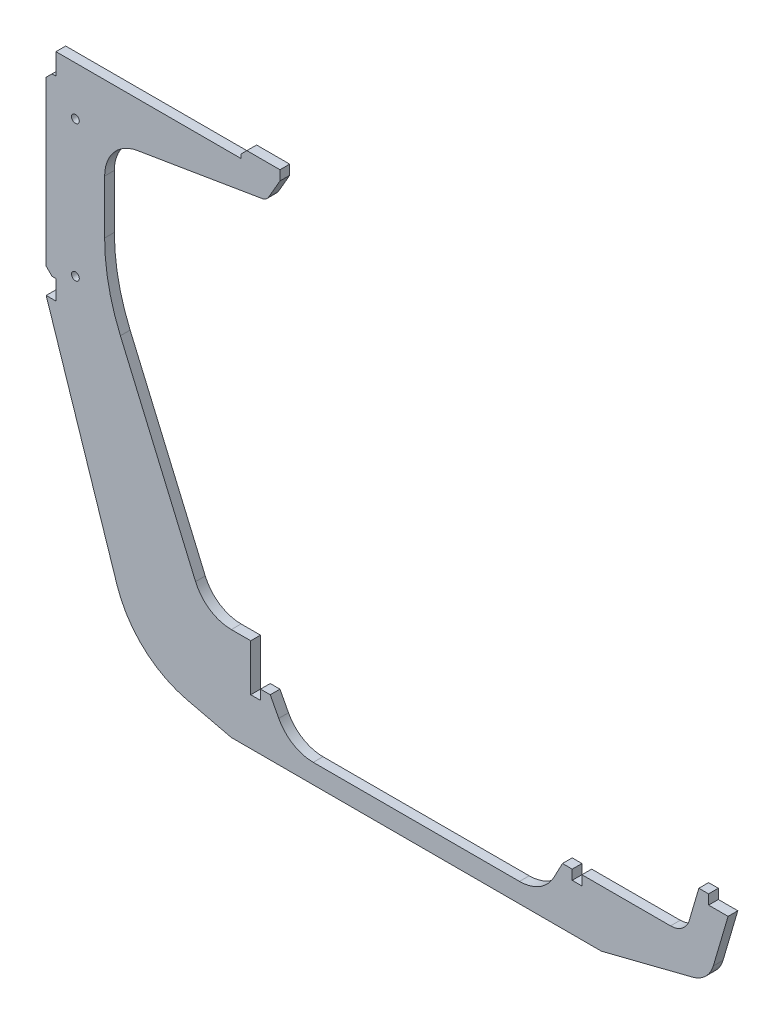
from build123d import *

# Parameters (mm, degrees)
SZKIC1_R                    = 2
DODANIE_WYCI_GNI_CIE1_DEPTH = 5


with BuildPart() as part:
    # Szkic1 → Dodanie-wyciągnięcie1 (new body)
    with BuildSketch(Plane.XY):
        with BuildLine():
            Line((-65.202627062, -126.434402055), (124.797372938, -126.434402055))
            Line((124.797372938, -126.434402055), (171.499327319, -114.603240278))
            ThreePointArc((171.499327319, -114.603240278), (178.222064331, -110.865700346), (182.208416061, -104.287448484))
            Line((182.208416061, -104.287448484), (189.797372938, -78.434402055))
            Line((189.797372938, -78.434402055), (179.797372938, -78.434402055))
            Line((179.797372938, -78.434402055), (179.797372938, -73.434402055))
            Line((179.797372938, -73.434402055), (174.797372938, -73.434402055))
            Line((174.797372938, -73.434402055), (169.860999207, -90.250981899))
            ThreePointArc((169.860999207, -90.250981899), (166.258938288, -95.439581579), (160.265850538, -97.434402055))
            Line((160.265850538, -97.434402055), (114.797372938, -97.434402055))
            Line((114.797372938, -97.434402055), (114.797372938, -102.434402055))
            Line((114.797372938, -102.434402055), (109.797372938, -102.434402055))
            Line((109.797372938, -102.434402055), (109.797372938, -97.434402055))
            Line((109.797372938, -97.434402055), (104.797372938, -97.434402055))
            Line((104.797372938, -97.434402055), (100.421094698, -105.749330711))
            ThreePointArc((100.421094698, -105.749330711), (93.059592126, -113.556004975), (82.72273025, -116.434402055))
            Line((82.72273025, -116.434402055), (-23.127984374, -116.434402055))
            ThreePointArc((-23.127984374, -116.434402055), (-33.464846249, -113.556004975), (-40.826348821, -105.749330711))
            Line((-40.826348821, -105.749330711), (-45.202627062, -97.434402055))
            Line((-45.202627062, -97.434402055), (-50.202627062, -97.434402055))
            Line((-50.202627062, -97.434402055), (-50.202627062, -102.434402055))
            Line((-50.202627062, -102.434402055), (-55.202627062, -102.434402055))
            Line((-55.202627062, -102.434402055), (-55.202627062, -78.434402055))
            Line((-55.202627062, -78.434402055), (-65.157561045, -78.434402055))
            ThreePointArc((-65.157561045, -78.434402055), (-76.16738122, -75.131223899), (-83.540461645, -66.312788026))
            Line((-83.540461645, -66.312788026), (-122.117130064, 23.699438283))
            ThreePointArc((-122.117130064, 23.699438283), (-128.160399342, 42.984780914), (-130.202627062, 63.091368141))
            Line((-130.202627062, 63.091368141), (-130.202627062, 90.623056178))
            ThreePointArc((-130.202627062, 90.623056178), (-125.463026711, 103.5505541), (-113.490606808, 110.350934654))
            Line((-113.490606808, 110.350934654), (-49.477900362, 121.019719062))
            ThreePointArc((-49.477900362, 121.019719062), (-47.45126243, 121.842517137), (-45.96976828, 123.451688681))
            Line((-45.96976828, 123.451688681), (-40.202627062, 133.440670285))
            Line((-40.202627062, 133.440670285), (-40.202627062, 138.440670285))
            Line((-40.202627062, 138.440670285), (-57.202627062, 138.440670285))
            Line((-57.202627062, 138.440670285), (-60.202627062, 135.440670285))
            Line((-60.202627062, 135.440670285), (-60.202627062, 133.440670285))
            Line((-60.202627062, 133.440670285), (-155.202627062, 133.440670285))
            Line((-155.202627062, 133.440670285), (-155.202627062, 122.565597945))
            Line((-155.202627062, 122.565597945), (-157.202627062, 122.565597945))
            Line((-157.202627062, 122.565597945), (-160.202627062, 119.565597945))
            Line((-160.202627062, 119.565597945), (-160.202627062, 35.565597945))
            Line((-160.202627062, 35.565597945), (-157.202627062, 32.565597945))
            Line((-157.202627062, 32.565597945), (-155.202627062, 32.565597945))
            Line((-155.202627062, 32.565597945), (-155.202627062, 22.565597945))
            Line((-155.202627062, 22.565597945), (-160.202627062, 22.565597945))
            Line((-160.202627062, 22.565597945), (-123.814002373, -88.030510267))
            ThreePointArc((-123.814002373, -88.030510267), (-110.145816986, -109.223759508), (-87.872395851, -121.050331967))
            Line((-87.872395851, -121.050331967), (-65.202627062, -126.434402055))
        make_face()
        with Locations((-145.202627062, 38.565597945)):
            Circle(SZKIC1_R, mode=Mode.SUBTRACT)
        with Locations((-145.202627062, 108.565597945)):
            Circle(SZKIC1_R, mode=Mode.SUBTRACT)
    extrude(amount=DODANIE_WYCI_GNI_CIE1_DEPTH)


solid = part.part
